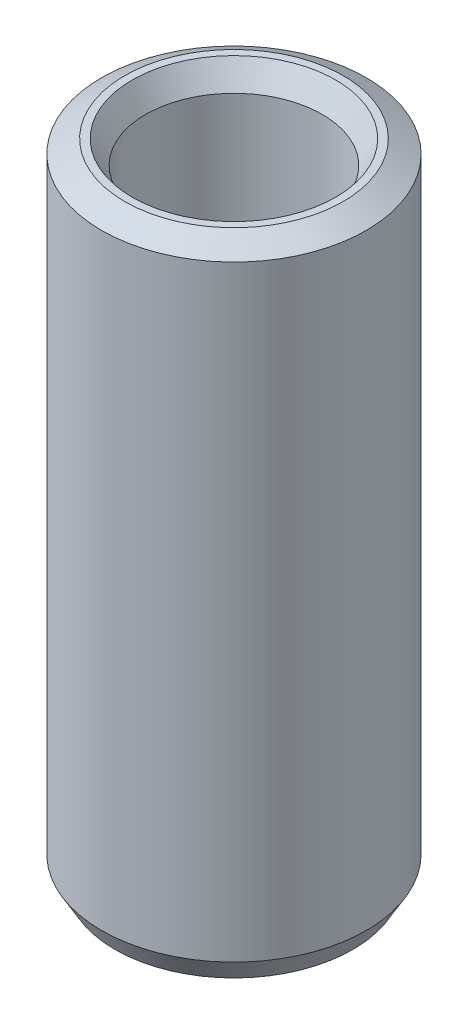
from build123d import *
from OCP.BRepFilletAPI import BRepFilletAPI_MakeChamfer

# Parameters (mm, degrees)
SKETCH1_R           = 22.5
BOSS_EXTRUDE1_DEPTH = 109.298146088
SKETCH2_R           = 15.012433769
CUT_EXTRUDE1_DEPTH  = 114.835779692
CHAMFER1_SIZE       = 2.274540452
CHAMFER1_SIZE2      = 3.939619627


with BuildPart() as part:
    # Sketch1 → Boss-Extrude1 (new body)
    with BuildSketch(Plane(origin=(0, 0, 0), x_dir=(1, 0, 0), z_dir=(0, 1, 0))):
        Circle(SKETCH1_R)
    extrude(amount=BOSS_EXTRUDE1_DEPTH)

    # Sketch2 → Cut-Extrude1 (cut, through all)
    with BuildSketch(Plane(origin=(0, 0, 0), x_dir=(1, 0, 0), z_dir=(0, 1, 0))):
        Circle(SKETCH2_R)
    extrude(amount=CUT_EXTRUDE1_DEPTH, mode=Mode.SUBTRACT)

    # Chamfer1: one chamfer whose edges measure the first distance from different faces: ONE call of the kernel's chamfer builder (chamfer() names one face for all edges)
    chamfer1_edges_1 = [part.edges().sort_by_distance(p)[0] for p in [
        (-15.012433769, 109.298146088, 0),
    ]]
    chamfer1_side_1 = [part.faces().sort_by_distance(p)[0] for p in [
        (-21.863603897, 109.298146088, 0),
    ]]
    chamfer1_edges_2 = [part.edges().sort_by_distance(p)[0] for p in [
        (-15.012433769, 0, 0),
    ]]
    chamfer1_side_2 = [part.faces().sort_by_distance(p)[0] for p in [
        (-15.012433769, 54.649073044, 0),
    ]]
    chamfer1_edges_3 = [part.edges().sort_by_distance(p)[0] for p in [
        (-22.5, 0, 0),
    ]]
    chamfer1_side_3 = [part.faces().sort_by_distance(p)[0] for p in [
        (-21.863603897, 0, 0),
    ]]
    chamfer1_edges_4 = [part.edges().sort_by_distance(p)[0] for p in [
        (-22.5, 109.298146088, 0),
    ]]
    chamfer1_side_4 = [part.faces().sort_by_distance(p)[0] for p in [
        (-22.5, 54.649073044, 0),
    ]]
    chamfer1 = BRepFilletAPI_MakeChamfer(part.part.solid().wrapped)
    for e in chamfer1_edges_1:
        chamfer1.Add(CHAMFER1_SIZE, CHAMFER1_SIZE2, e.wrapped, chamfer1_side_1[0].wrapped)  # the first distance lies on this face
    for e in chamfer1_edges_2:
        chamfer1.Add(CHAMFER1_SIZE, CHAMFER1_SIZE2, e.wrapped, chamfer1_side_2[0].wrapped)  # the first distance lies on this face
    for e in chamfer1_edges_3:
        chamfer1.Add(CHAMFER1_SIZE, CHAMFER1_SIZE2, e.wrapped, chamfer1_side_3[0].wrapped)  # the first distance lies on this face
    for e in chamfer1_edges_4:
        chamfer1.Add(CHAMFER1_SIZE, CHAMFER1_SIZE2, e.wrapped, chamfer1_side_4[0].wrapped)  # the first distance lies on this face
    add(Compound.cast(chamfer1.Shape()), mode=Mode.REPLACE)


solid = part.part
